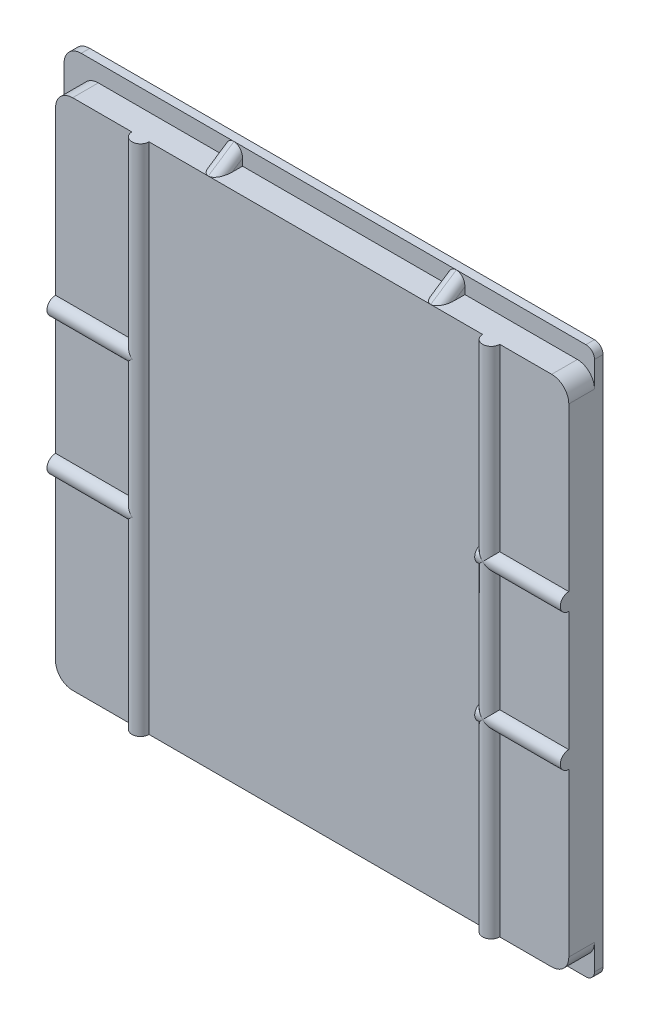
from build123d import *

# Parameters (mm, degrees)
BOSS_EXTRUDE1_DEPTH  = 5
BOSS_EXTRUDE2_DEPTH  = 15
BOSS_EXTRUDE3_DEPTH  = 10
FILLET1_R            = 5
BOSS_EXTRUDE7_DEPTH  = 10
BOSS_EXTRUDE8_DEPTH  = 10
BOSS_EXTRUDE9_DEPTH  = 10
FILLET5_R            = 5
BOSS_EXTRUDE10_DEPTH = 300
BOSS_EXTRUDE12_DEPTH = 50
BOSS_EXTRUDE13_START = -50
BOSS_EXTRUDE13_DEPTH = 50
CUT_EXTRUDE1_DEPTH   = 12
FILLET7_R            = 5
FILLET8_R            = 3
SKETCH17_W           = 10
SKETCH17_H           = 320
CUT_EXTRUDE2_DEPTH   = 10
FILLET9_R            = 5
SKETCH18_R           = 2.5
CUT_EXTRUDE3_DEPTH   = 10


with BuildPart() as part:
    # Sketch1 → Boss-Extrude1 (new body)
    with BuildSketch(Plane.XY):
        with BuildLine():
            Line((-274.292008101, 30.516404424), (25.707991899, 30.516404424))
            ThreePointArc((25.707991899, 30.516404424), (32.779059711, 27.587472236), (35.707991899, 20.516404424))
            Line((35.707991899, 20.516404424), (35.707991899, -279.483595576))
            ThreePointArc((35.707991899, -279.483595576), (32.779059711, -286.554663388), (25.707991899, -289.483595576))
            Line((25.707991899, -289.483595576), (-274.292008101, -289.483595576))
            ThreePointArc((-274.292008101, -289.483595576), (-281.363075913, -286.554663388), (-284.292008101, -279.483595576))
            Line((-284.292008101, -279.483595576), (-284.292008101, 20.516404424))
            ThreePointArc((-284.292008101, 20.516404424), (-281.363075913, 27.587472236), (-274.292008101, 30.516404424))
        make_face()
    extrude(amount=BOSS_EXTRUDE1_DEPTH)

    # Sketch2 → Boss-Extrude2 (add)
    with BuildSketch(Plane.XY.offset(5)):
        with BuildLine():
            Line((-264.292008101, 20.516404424), (15.707991899, 20.516404424))
            ThreePointArc((15.707991899, 20.516404424), (22.779059711, 17.587472236), (25.707991899, 10.516404424))
            Line((25.707991899, 10.516404424), (25.707991899, -269.483595576))
            ThreePointArc((25.707991899, -269.483595576), (22.779059711, -276.554663388), (15.707991899, -279.483595576))
            Line((15.707991899, -279.483595576), (-264.292008101, -279.483595576))
            ThreePointArc((-264.292008101, -279.483595576), (-271.363075913, -276.554663388), (-274.292008101, -269.483595576))
            Line((-274.292008101, -269.483595576), (-274.292008101, 10.516404424))
            ThreePointArc((-274.292008101, 10.516404424), (-271.363075913, 17.587472236), (-264.292008101, 20.516404424))
        make_face()
    extrude(amount=BOSS_EXTRUDE2_DEPTH)

    # Sketch3 → Boss-Extrude3 (add)
    with BuildSketch(Plane(origin=(-60, 0, 0), x_dir=(0, 0, -1), z_dir=(1, 0, 0))):
        Polygon((-20, 20.516404424), (-5, 20.516404424), (-5, 30.516404424), align=None)
    extrude(amount=BOSS_EXTRUDE3_DEPTH)

    # Fillet1
    fillet1_edges = [part.edges().sort_by_distance(p)[0] for p in [
        (-60, 25.516404424, 12.5),
        (-50, 25.516404424, 12.5),
    ]]
    fillet(fillet1_edges, radius=FILLET1_R - 0.0001)  # a hair under: the kernel refuses the full size

    # Sketch4 → Boss-Extrude7 (add)
    with BuildSketch(Plane(origin=(-180, 0, 0), x_dir=(0, 0, -1), z_dir=(1, 0, 0))):
        Polygon((-20, 20.516404424), (-5, 20.516404424), (-5, 30.516404424), align=None)
    extrude(amount=-BOSS_EXTRUDE7_DEPTH)

    # Sketch9 → Boss-Extrude8 (add)
    with BuildSketch(Plane(origin=(-180, 0, 0), x_dir=(0, 0, -1), z_dir=(1, 0, 0))):
        Polygon((-20, -279.483595576), (-5, -279.483595576), (-5, -289.483595576), align=None)
    extrude(amount=-BOSS_EXTRUDE8_DEPTH)

    # Sketch10 → Boss-Extrude9 (add)
    with BuildSketch(Plane(origin=(-60, 0, 0), x_dir=(0, 0, -1), z_dir=(1, 0, 0))):
        Polygon((-20, -279.483595576), (-5, -279.483595576), (-5, -289.483595576), align=None)
    extrude(amount=BOSS_EXTRUDE9_DEPTH)

    # Fillet5
    fillet5_edges = [part.edges().sort_by_distance(p)[0] for p in [
        (-60, -284.483595576, 12.5),
        (-50, -284.483595576, 12.5),
        (-190, 25.516404424, 12.5),
        (-180, 25.516404424, 12.5),
        (-190, -284.483595576, 12.5),
        (-180, -284.483595576, 12.5),
    ]]
    fillet(fillet5_edges, radius=FILLET5_R - 0.0001)  # a hair under: the kernel refuses the full size

    # Sketch12 → Boss-Extrude10 (add)
    with BuildSketch(Plane.XZ.offset(279.483595576)):
        with BuildLine():
            Line((-229.64600405, 20), (-219.64600405, 20))
            ThreePointArc((-219.64600405, 20), (-224.64600405, 25), (-229.64600405, 20))
        make_face()
        with BuildLine():
            Line((-24.64600405, 20), (-14.64600405, 20))
            ThreePointArc((-14.64600405, 20), (-19.64600405, 25), (-24.64600405, 20))
        make_face()
    extrude(amount=-BOSS_EXTRUDE10_DEPTH)

    # Sketch13 → Boss-Extrude12 (add)
    with BuildSketch(Plane.ZY.offset(274.292008101)):
        with BuildLine():
            Line((20, -84.483595576), (20, -94.483595576))
            ThreePointArc((20, -94.483595576), (25, -89.483595576), (20, -84.483595576))
        make_face()
        with BuildLine():
            Line((20, -164.483595576), (20, -174.483595576))
            ThreePointArc((20, -174.483595576), (25, -169.483595576), (20, -164.483595576))
        make_face()
    extrude(amount=-BOSS_EXTRUDE12_DEPTH)

    # Sketch15 → Boss-Extrude13 (add)
    with BuildSketch(Plane(origin=(25.707991899, 0, 0), x_dir=(0, 0, -1), z_dir=(1, 0, 0)).offset(BOSS_EXTRUDE13_START)):
        with BuildLine():
            Line((-20, -84.483595576), (-20, -94.483595576))
            ThreePointArc((-20, -94.483595576), (-25, -89.483595576), (-20, -84.483595576))
        make_face()
        with BuildLine():
            Line((-20, -164.483595576), (-20, -174.483595576))
            ThreePointArc((-20, -174.483595576), (-25, -169.483595576), (-20, -164.483595576))
        make_face()
    extrude(amount=BOSS_EXTRUDE13_DEPTH)

    # Sketch16 → Cut-Extrude1 (cut)
    with BuildSketch(Plane(origin=(0, 0, 0), x_dir=(-1, 0, 0), z_dir=(0, 0, -1))):
        Polygon((14.292008101, 10.516404424), (264.292008101, 10.516404424), (264.292008101, -269.483595576), (14.292008101, -269.483595576), (14.292008101, -189.483595576), (-15.707991899, -189.483595576), (-15.707991899, -69.483595576), (14.292008101, -69.483595576), align=None)
    extrude(amount=-CUT_EXTRUDE1_DEPTH, mode=Mode.SUBTRACT)

    # Fillet7
    fillet7_edges = [part.edges().sort_by_distance(p)[0] for p in [
        (-14.292008101, -69.483595576, 6),
        (-14.292008101, 10.516404424, 6),
        (-264.292008101, 10.516404424, 6),
        (-264.292008101, -269.483595576, 6),
        (-14.292008101, -269.483595576, 6),
        (-14.292008101, -189.483595576, 6),
        (15.707991899, -189.483595576, 6),
        (15.707991899, -69.483595576, 6),
    ]]
    fillet(fillet7_edges, radius=FILLET7_R)

    # Fillet8
    fillet8_edges = [part.edges().sort_by_distance(p)[0] for p in [
        (-264.292008101, -129.483595576, 12),
        (-139.292008101, -269.483595576, 12),
        (-14.292008101, -29.483595576, 12),
        (0.707991899, -69.483595576, 12),
        (15.707991899, -129.483595576, 12),
        (0.707991899, -189.483595576, 12),
        (-14.292008101, -229.483595576, 12),
        (-139.292008101, 10.516404424, 12),
        (-262.827542007, 9.05193833, 12),
        (-15.756474195, 9.05193833, 12),
        (14.243525805, -70.94806167, 12),
        (14.243525805, -188.019129482, 12),
        (-15.756474195, -268.019129482, 12),
        (-262.827542007, -268.019129482, 12),
        (-12.827542007, -190.94806167, 12),
        (-12.827542007, -68.019129482, 12),
    ]]
    fillet(fillet8_edges, radius=FILLET8_R)

    # Sketch17 → Cut-Extrude2 (cut)
    with BuildSketch(Plane(origin=(0, 0, 0), x_dir=(-1, 0, 0), z_dir=(0, 0, -1))):
        with Locations((-30.707991899, -129.483595576)):
            Rectangle(SKETCH17_W, SKETCH17_H)
    extrude(amount=-CUT_EXTRUDE2_DEPTH, mode=Mode.SUBTRACT)

    # Fillet9
    fillet9_edges = [part.edges().sort_by_distance(p)[0] for p in [
        (25.707991899, -289.483595576, 2.5),
        (25.707991899, 30.516404424, 2.5),
    ]]
    fillet(fillet9_edges, radius=FILLET9_R)

    # Sketch18 → Cut-Extrude3 (cut)
    with BuildSketch(Plane(origin=(0, 0, 0), x_dir=(-1, 0, 0), z_dir=(0, 0, -1))):
        with Locations((4.292008101, -4.483595576)):
            Circle(SKETCH18_R)
        with Locations((-15.507991899, -29.483595576)):
            Circle(SKETCH18_R)
        with Locations((4.292008101, -54.483595576)):
            Circle(SKETCH18_R)
        with Locations((4.292008101, -204.483595576)):
            Circle(SKETCH18_R)
        with Locations((-13.25844967, -229.483595576)):
            Circle(SKETCH18_R)
        with Locations((4.292008101, -254.483595576)):
            Circle(SKETCH18_R)
    extrude(amount=-CUT_EXTRUDE3_DEPTH, mode=Mode.SUBTRACT)


solid = part.part
